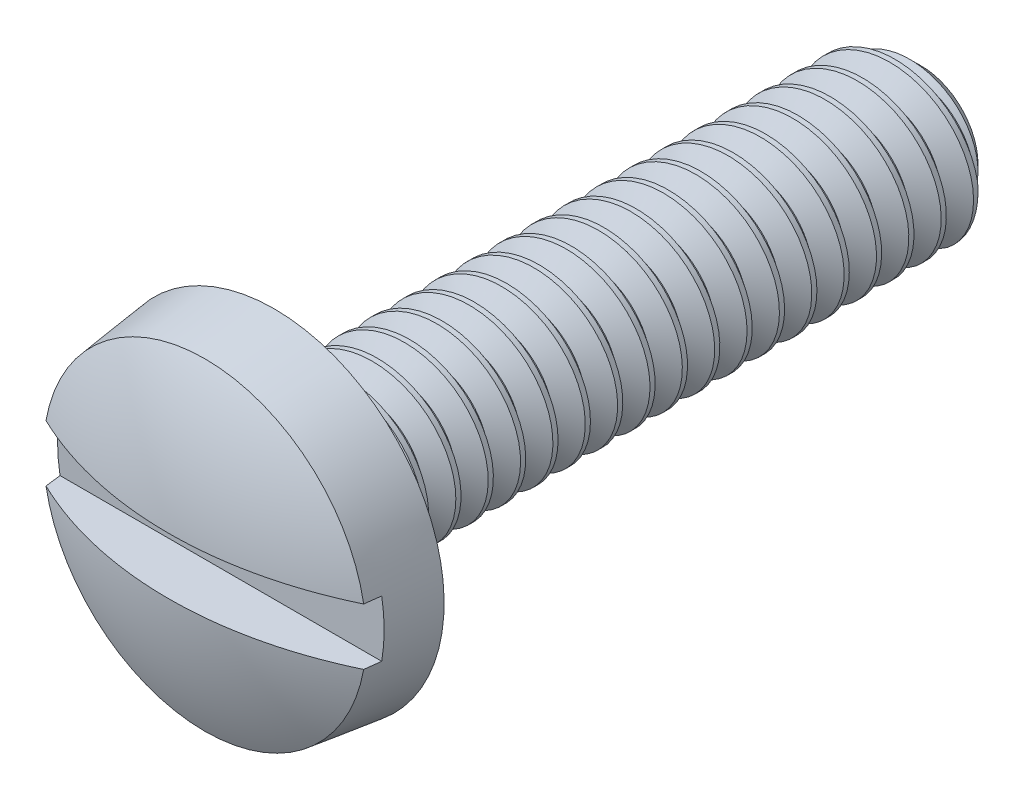
from build123d import *

# Parameters (mm, degrees)
SKETCH1_R        = 6.6675
EXTRUDE3_DEPTH   = 4.191
SKETCH4_W        = 25.4
SKETCH4_H        = 3.175
CHAMFER2_SIZE    = 0.9525
CUT_SWEEP1_PITCH = 1.27
SKETCH26_R       = 0.5461
EXTRUDE13_DEPTH  = 4.180644535
SKETCH31_W       = 13.335
SKETCH31_H       = 2.2225
EXTRUDE15_DEPTH  = 2.0955


with BuildPart() as part:
    # Sketch1 → Extrude3 (new body)
    with BuildSketch(Plane.XY):
        Circle(SKETCH1_R)
    extrude(amount=EXTRUDE3_DEPTH)

    # Sketch11 → Cut-Revolve3 (revolve, cut)
    with BuildSketch(Plane(origin=(0, 0, 0), x_dir=(0, 0, -1), z_dir=(1, 0, 0))):
        with BuildLine():
            Line((-4.445, 6.9342), (0, 6.9342))
            Line((0, 6.9342), (0, 6.6675))
            Line((0, 6.6675), (-2.72415, 6.333016438))
            ThreePointArc((-2.72415, 6.333016438), (-3.819496854, 3.250336372), (-4.191, 0))
            Line((-4.191, 0), (-4.445, 0))
            Line((-4.445, 0), (-4.445, 6.9342))
        make_face()
    revolve(axis=Axis((0, 0, 0), (0, 0, 1)), mode=Mode.SUBTRACT)



with BuildPart() as body_2:
    # Sketch4 → Revolve1 (revolve)
    with BuildSketch(Plane(origin=(0, 0, 0), x_dir=(0, 0, -1), z_dir=(1, 0, 0)), mode=Mode.PRIVATE) as revolve1_sk:
        with Locations((12.7, 1.5875)):
            Rectangle(SKETCH4_W, SKETCH4_H)
    revolve(revolve1_sk.sketch.rotate(Axis((0, 0, 0), (0, 0, -1)), 90), axis=Axis((0, 0, 0), (0, 0, -1)))

    # Chamfer2
    chamfer2_edges = [body_2.edges().sort_by_distance(p)[0] for p in [
        (-3.175, 0, -25.4),
    ]]
    chamfer(chamfer2_edges, length=CHAMFER2_SIZE)

    # Cut-Sweep1: the profile of Sketch14 screwed along a right-hand helix of 23.3 turns, 8 arcs to a turn; built about Z, then put on its axis
    cut_sweep1_z = Axis((0, 0, 0), (0, 0, 1))
    cut_sweep1_corners = [(0, 3.2146875, 0), (0, 3.2146875, -1.11125), (0, 2.355509757, -0.635), (0, 2.355509757, -0.47625)]
    with BuildLine(mode=Mode.PRIVATE) as cut_sweep1_profile:
        Line(cut_sweep1_corners[0], cut_sweep1_corners[1])
        Line(cut_sweep1_corners[1], cut_sweep1_corners[2])
        Line(cut_sweep1_corners[2], cut_sweep1_corners[3])
        Line(cut_sweep1_corners[3], cut_sweep1_corners[0])
    cut_sweep1_cap = Face(cut_sweep1_profile.wire())
    cut_sweep1_turn_angles = [0, 22.5, 45, 67.5, 90, 112.5, 135, 157.5, 180, 202.5, 225, 247.5, 270, 292.5, 315, 337.5, 360]
    cut_sweep1_turn_weights = [1, 0.9238795325112867, 1, 0.9238795325112867, 1, 0.9238795325112867, 1, 0.9238795325112867, 1, 0.9238795325112867, 1, 0.9238795325112867, 1, 0.9238795325112867, 1, 0.9238795325112867, 1]
    cut_sweep1_turn_rails = [Edge.make_bspline([Vector(p[0], p[1], 0).rotate(cut_sweep1_z, cut_sweep1_turn_angles[k]) / cut_sweep1_turn_weights[k] + Vector(0, 0, p[2] + CUT_SWEEP1_PITCH * cut_sweep1_turn_angles[k] / 360) for k in range(17)], [0, 0, 0, 1, 1, 2, 2, 3, 3, 4, 4, 5, 5, 6, 6, 7, 7, 8, 8, 8], 2, cut_sweep1_turn_weights) for p in cut_sweep1_corners]
    cut_sweep1_turn_sides = [Face.make_surface_from_curves(cut_sweep1_turn_rails[p[0]], cut_sweep1_turn_rails[p[1]]) for p in [(0, 1), (1, 2), (2, 3), (3, 0)]]
    cut_sweep1_last_angles = [8280, 8302.5, 8325, 8347.5, 8370, 8379, 8388]
    cut_sweep1_last_weights = [1, 0.9238795325112867, 1, 0.9238795325112867, 1, 0.9876883405951129, 1]
    cut_sweep1_last_rails = [Edge.make_bspline([Vector(p[0], p[1], 0).rotate(cut_sweep1_z, cut_sweep1_last_angles[k]) / cut_sweep1_last_weights[k] + Vector(0, 0, p[2] + CUT_SWEEP1_PITCH * cut_sweep1_last_angles[k] / 360) for k in range(7)], [0, 0, 0, 1, 1, 2, 2, 3, 3, 3], 2, cut_sweep1_last_weights) for p in cut_sweep1_corners]
    cut_sweep1_last_sides = [Face.make_surface_from_curves(cut_sweep1_last_rails[p[0]], cut_sweep1_last_rails[p[1]]) for p in [(0, 1), (1, 2), (2, 3), (3, 0)]]
    cut_sweep1 = Plane(origin=(0, 0, -25.4), x_dir=(1, 0, 0), z_dir=(0, 0, 1)) * Solid(Shell([*[p.moved(Location((0, 0, CUT_SWEEP1_PITCH * i))) for i in range(23) for p in cut_sweep1_turn_sides], *cut_sweep1_last_sides, cut_sweep1_cap, cut_sweep1_cap.rotate(cut_sweep1_z, 8388).moved(Location((0, 0, CUT_SWEEP1_PITCH * 8388 / 360)))]))
    add(cut_sweep1, mode=Mode.SUBTRACT)


with BuildPart() as part_1:
    add(part.part)

    add(body_2.part)  # Extrude13 merges body 2
    # Sketch26 → Extrude13 (add)
    with BuildSketch(Plane.XY):
        Circle(SKETCH26_R)
    extrude(amount=EXTRUDE13_DEPTH)

    # Sketch31 → Extrude15 (cut)
    with BuildSketch(Plane.XY.offset(4.191)):
        Rectangle(SKETCH31_W, SKETCH31_H)
    extrude(amount=-EXTRUDE15_DEPTH, mode=Mode.SUBTRACT)


solid = part_1.part
